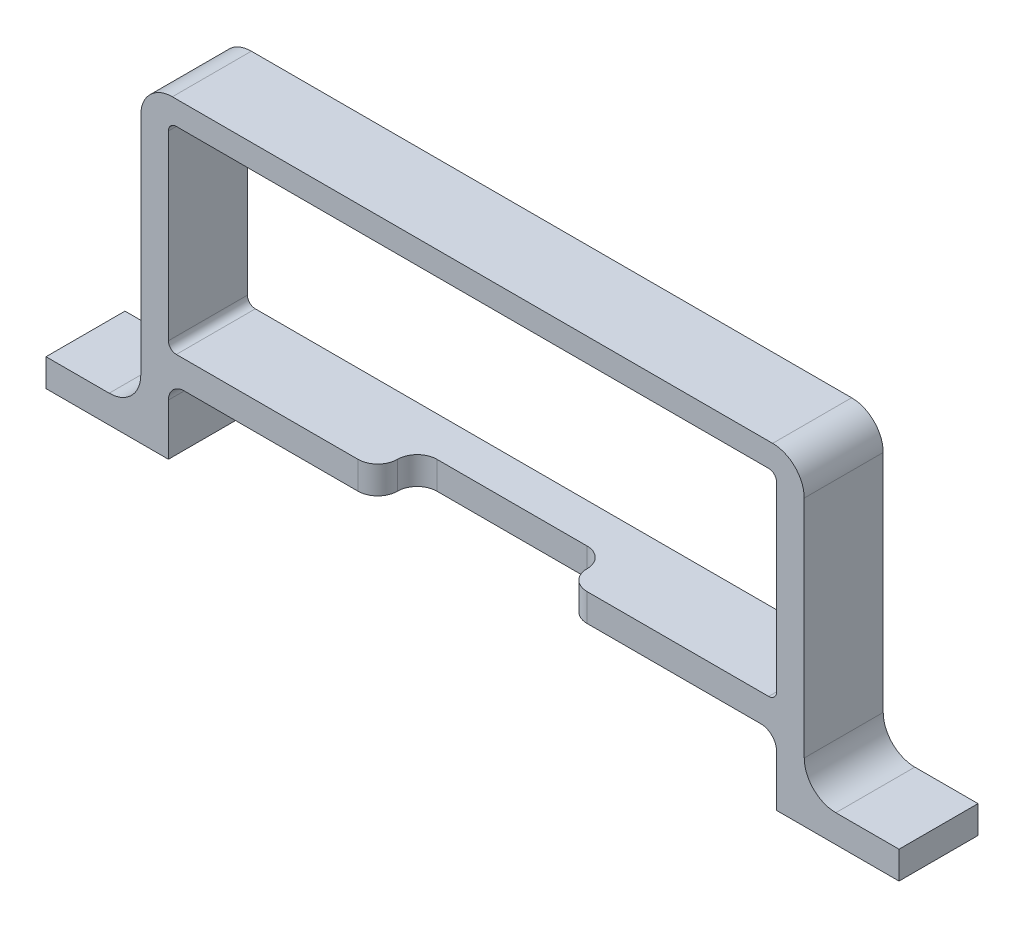
from build123d import *

# Parameters (mm, degrees)
SALIENTE_EXTRUIR2_DEPTH = 10
CROQUIS9_W              = 24
CROQUIS9_H              = 7
CORTAR_EXTRUIR2_DEPTH   = 5
REDONDEO3_R             = 2.5


with BuildPart() as part:
    # Croquis1 → Saliente-Extruir2 (new body)
    with BuildSketch(Plane.XY):
        with BuildLine():
            ThreePointArc((-38.687161159, 0.254415054), (-39.39426794, 0.547308273), (-39.687161159, 1.254415054))
            Line((-39.687161159, 1.254415054), (-39.687161159, 24.254415054))
            ThreePointArc((-39.687161159, 24.254415054), (-39.39426794, 24.961521836), (-38.687161159, 25.254415054))
            Line((-38.687161159, 25.254415054), (-1.187161159, 25.254415054))
            Line((-1.187161159, 25.254415054), (-1.187161159, 28.254415054))
            Line((-1.187161159, 28.254415054), (-39.187161159, 28.254415054))
            ThreePointArc((-39.187161159, 28.254415054), (-42.015588284, 27.082842179), (-43.187161159, 24.254415054))
            Line((-43.187161159, 24.254415054), (-43.187161159, -3.245584946))
            Line((-43.187161159, -3.245584946), (-43.187161159, -4.245584946))
            ThreePointArc((-43.187161159, -4.245584946), (-44.358734034, -7.07401207), (-47.187161159, -8.245584946))
            Line((-47.187161159, -8.245584946), (-55.187161159, -8.245584946))
            Line((-55.187161159, -8.245584946), (-55.187161159, -11.745584946))
            Line((-55.187161159, -11.745584946), (-43.187161159, -11.745584946))
            Line((-43.187161159, -11.745584946), (-39.687161159, -11.745584946))
            Line((-39.687161159, -11.745584946), (-39.687161159, -5.245584946))
            ThreePointArc((-39.687161159, -5.245584946), (-39.101374721, -3.831371383), (-37.687161159, -3.245584946))
            Line((-37.687161159, -3.245584946), (-1.187161159, -3.245584946))
            Line((-1.187161159, -3.245584946), (-1.187161159, 0.254415054))
            Line((-1.187161159, 0.254415054), (-38.687161159, 0.254415054))
        make_face()
    saliente_extruir2 = extrude(amount=SALIENTE_EXTRUIR2_DEPTH)

    # Simetría2: Saliente-Extruir2 across plane
    add(saliente_extruir2.mirror(Plane(origin=(-1.187161159, 0, 10), x_dir=(0, 0, 1), z_dir=(-1, 0, 0))))

    # Croquis9 → Cortar-Extruir2 (cut)
    with BuildSketch(Plane.XY.offset(10)):
        with Locations((-1.187161159, -3.245584946)):
            Rectangle(CROQUIS9_W, CROQUIS9_H)
    extrude(amount=-CORTAR_EXTRUIR2_DEPTH, mode=Mode.SUBTRACT)

    # Redondeo3
    redondeo3_edges = [part.edges().sort_by_distance(p)[0] for p in [
        (10.812838841, -1.495584946, 5),
        (-13.187161159, -1.495584946, 5),
    ]]
    fillet(redondeo3_edges, radius=REDONDEO3_R)
    redondeo3_2_edges = [part.edges().sort_by_distance(p)[0] for p in [
        (10.812838841, -1.495584946, 10),
        (-13.187161159, -1.495584946, 10),
    ]]
    fillet(redondeo3_2_edges, radius=REDONDEO3_R - 0.0001)  # a hair under: the kernel refuses the full size


solid = part.part
